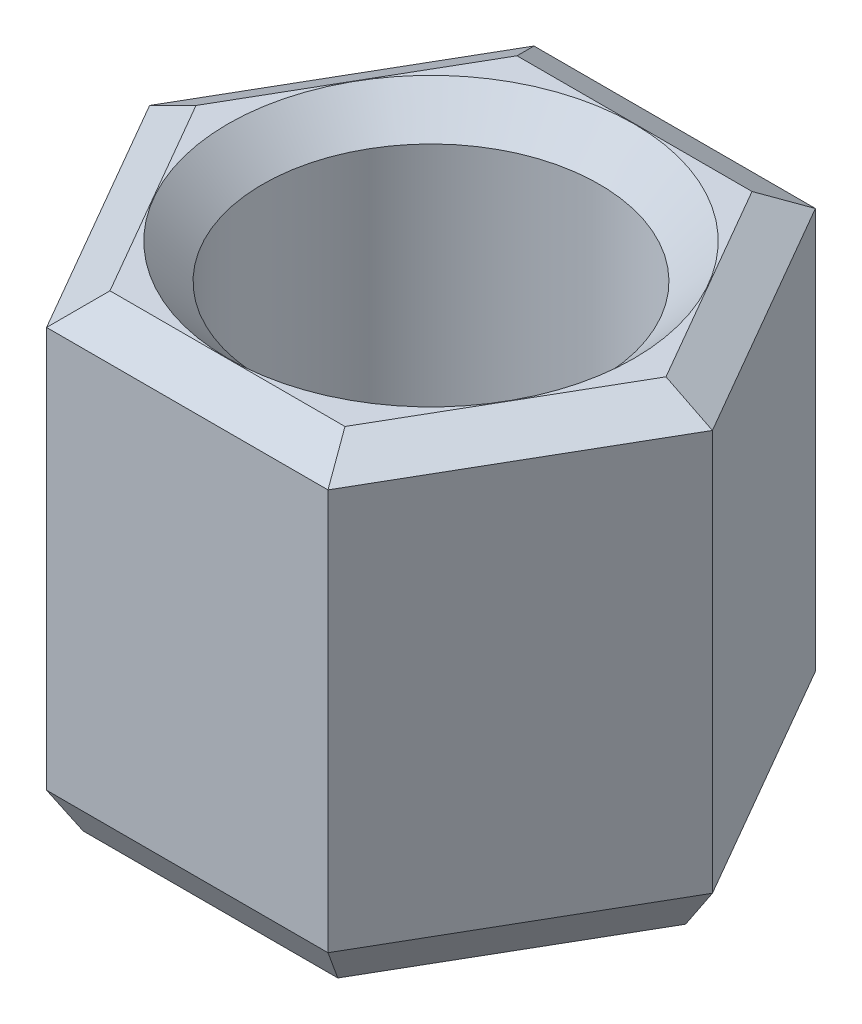
from build123d import *
from OCP.BRepFilletAPI import BRepFilletAPI_MakeChamfer

# Parameters (mm, degrees)
SKETCH1_R           = 7.25
BOSS_EXTRUDE1_DEPTH = 10
CHAMFER2_SIZE       = 1
CHAMFER2_SIZE2      = 1.732050808


with BuildPart() as part:
    # Sketch1 → Boss-Extrude1 (new, symmetric)
    with BuildSketch(Plane(origin=(0, 0, 0), x_dir=(1, 0, 0), z_dir=(0, 1, 0))):
        Polygon((-12.124355653, 0), (-6.062177826, -10.5), (6.062177826, -10.5), (12.124355653, 0), (6.062177826, 10.5), (-6.062177826, 10.5), align=None)
        with Locations(Location((0, 0, 0), (0, 0, 270))):
            Circle(SKETCH1_R, mode=Mode.SUBTRACT)
    extrude(amount=BOSS_EXTRUDE1_DEPTH, both=True)

    # Chamfer1: read off the stored shape, not the designer's step
    # Chamfer1 outline → Chamfer1 (revolve, cut)
    with BuildSketch(Plane.XY):
        Polygon((7.25, 10), (7.25, 8.5), (8.75, 10), align=None)
    revolve(axis=Axis((0, 0, 0), (0, 1, 0)), mode=Mode.SUBTRACT)

    # Chamfer2: one chamfer whose edges measure the first distance from different faces: ONE call of the kernel's chamfer builder (chamfer() names one face for all edges)
    chamfer2_edges_1 = [part.edges().sort_by_distance(p)[0] for p in [
        (0, 10, 10.5),
    ]]
    chamfer2_side_1 = [part.faces().sort_by_distance(p)[0] for p in [
        (0, 0, 10.5),
    ]]
    chamfer2_edges_2 = [part.edges().sort_by_distance(p)[0] for p in [
        (9.09326674, 10, 5.25),
    ]]
    chamfer2_side_2 = [part.faces().sort_by_distance(p)[0] for p in [
        (9.09326674, 0, 5.25),
    ]]
    chamfer2_edges_3 = [part.edges().sort_by_distance(p)[0] for p in [
        (9.09326674, 10, -5.25),
    ]]
    chamfer2_side_3 = [part.faces().sort_by_distance(p)[0] for p in [
        (9.09326674, 0, -5.25),
    ]]
    chamfer2_edges_4 = [part.edges().sort_by_distance(p)[0] for p in [
        (0, 10, -10.5),
    ]]
    chamfer2_side_4 = [part.faces().sort_by_distance(p)[0] for p in [
        (0, 0, -10.5),
    ]]
    chamfer2_edges_5 = [part.edges().sort_by_distance(p)[0] for p in [
        (-9.09326674, 10, -5.25),
    ]]
    chamfer2_side_5 = [part.faces().sort_by_distance(p)[0] for p in [
        (-9.09326674, 0, -5.25),
    ]]
    chamfer2_edges_6 = [part.edges().sort_by_distance(p)[0] for p in [
        (0, -10, -10.5),
        (9.09326674, -10, -5.25),
        (9.09326674, -10, 5.25),
        (0, -10, 10.5),
        (-9.09326674, -10, 5.25),
        (-9.09326674, -10, -5.25),
    ]]
    chamfer2_side_6 = [part.faces().sort_by_distance(p)[0] for p in [
        (-8.815462852, -10, 5.089609851),
    ]]
    chamfer2_edges_7 = [part.edges().sort_by_distance(p)[0] for p in [
        (-9.09326674, 10, 5.25),
    ]]
    chamfer2_side_7 = [part.faces().sort_by_distance(p)[0] for p in [
        (-9.09326674, 0, 5.25),
    ]]
    chamfer2 = BRepFilletAPI_MakeChamfer(part.part.solid().wrapped)
    for e in chamfer2_edges_1:
        chamfer2.Add(CHAMFER2_SIZE, CHAMFER2_SIZE2, e.wrapped, chamfer2_side_1[0].wrapped)  # the first distance lies on this face
    for e in chamfer2_edges_2:
        chamfer2.Add(CHAMFER2_SIZE, CHAMFER2_SIZE2, e.wrapped, chamfer2_side_2[0].wrapped)  # the first distance lies on this face
    for e in chamfer2_edges_3:
        chamfer2.Add(CHAMFER2_SIZE, CHAMFER2_SIZE2, e.wrapped, chamfer2_side_3[0].wrapped)  # the first distance lies on this face
    for e in chamfer2_edges_4:
        chamfer2.Add(CHAMFER2_SIZE, CHAMFER2_SIZE2, e.wrapped, chamfer2_side_4[0].wrapped)  # the first distance lies on this face
    for e in chamfer2_edges_5:
        chamfer2.Add(CHAMFER2_SIZE, CHAMFER2_SIZE2, e.wrapped, chamfer2_side_5[0].wrapped)  # the first distance lies on this face
    for e in chamfer2_edges_6:
        chamfer2.Add(CHAMFER2_SIZE, CHAMFER2_SIZE2, e.wrapped, chamfer2_side_6[0].wrapped)  # the first distance lies on this face
    for e in chamfer2_edges_7:
        chamfer2.Add(CHAMFER2_SIZE, CHAMFER2_SIZE2, e.wrapped, chamfer2_side_7[0].wrapped)  # the first distance lies on this face
    add(Compound.cast(chamfer2.Shape()), mode=Mode.REPLACE)


solid = part.part
